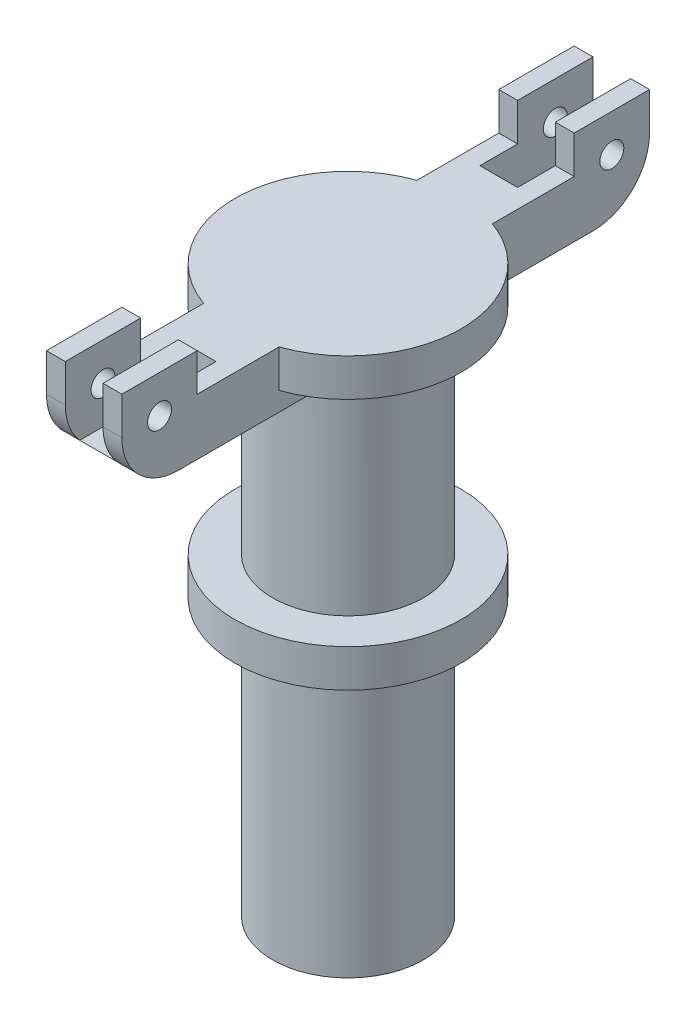
from build123d import *

# Parameters (mm, degrees)
SKETCH1_R            = 30
BOSS_EXTRUDE1_DEPTH  = 75
SKETCH2_W            = 10
SKETCH2_H            = 56.81
SKETCH2_H_2          = 73.19
SKETCH3_R            = 3.175
BOSS_EXTRUDE2_DEPTH  = 10
SKETCH5_W            = 10
SKETCH5_H            = 20
CUT_EXTRUDE2_DEPTH   = 30
FILLET1_R            = 15
FILLET1_OF_MIRROR1_R = 15


with BuildPart() as part:
    # Sketch1 → Boss-Extrude1 (new, symmetric)
    with BuildSketch(Plane(origin=(0, 0, 0), x_dir=(1, 0, 0), z_dir=(0, 1, 0))):
        with Locations(Location((0, 0, 0), (0, 0, 270))):
            Circle(SKETCH1_R)
    extrude(amount=BOSS_EXTRUDE1_DEPTH, both=True)

    # Sketch2 → Cut-Revolve1 (revolve, cut)
    with BuildSketch(Plane(origin=(0, 0, 0), x_dir=(0, 0, -1), z_dir=(1, 0, 0))):
        with Locations((25, 36.595)):
            Rectangle(SKETCH2_W, SKETCH2_H)
        with Locations((25, -38.405)):
            Rectangle(SKETCH2_W, SKETCH2_H_2)
    revolve(axis=Axis((0, -1000, 0), (0, 1, 0)), mode=Mode.SUBTRACT)

    # Sketch3 → Boss-Extrude2 (add, symmetric)
    with BuildSketch(Plane(origin=(0, 0, 0), x_dir=(0, 0, -1), z_dir=(1, 0, 0))):
        Polygon((0, 75), (0, 60), (70, 60), (70, 85), (50, 85), (50, 75), align=None)
        with Locations((60, 75)):
            Circle(SKETCH3_R, mode=Mode.SUBTRACT)
    boss_extrude2 = extrude(amount=BOSS_EXTRUDE2_DEPTH, both=True)

    # Sketch5 → Cut-Extrude2 (cut)
    with BuildSketch(Plane(origin=(0, 0, -70), x_dir=(-1, 0, 0), z_dir=(0, 0, -1))):
        with Locations((0, 75)):
            Rectangle(SKETCH5_W, SKETCH5_H)
    cut_extrude2 = extrude(amount=-CUT_EXTRUDE2_DEPTH, mode=Mode.SUBTRACT)

    # Fillet1
    # the kernel refuses this fillet: 15 mm, written as the material it takes off along each edge
    with BuildSketch(Plane(origin=(-47.5, 60, -70), x_dir=(0, 0, 1), z_dir=(1, 0, 0))) as fillet1_piece_1:
        with BuildLine():
            CenterArc((FILLET1_R, -FILLET1_R), FILLET1_R, 90, 90)
            Line((0, -FILLET1_R), (0, 0))
            Line((0, 0), (FILLET1_R, 0))
        make_face()
    extrude(amount=95, mode=Mode.SUBTRACT)

    # Mirror1: Boss-Extrude2, Cut-Extrude2 across plane
    add(boss_extrude2.mirror(Plane.XY))
    add(cut_extrude2.mirror(Plane.XY), mode=Mode.SUBTRACT)

    # Fillet1 of Mirror1
    # the kernel refuses this fillet: 15 mm, written as the material it takes off along each edge
    with BuildSketch(Plane(origin=(-47.5, 60, 70), x_dir=(0, 0, -1), z_dir=(1, 0, 0))) as fillet1_of_mirror1_piece_1:
        with BuildLine():
            CenterArc((FILLET1_OF_MIRROR1_R, FILLET1_OF_MIRROR1_R), FILLET1_OF_MIRROR1_R, 180, 90)
            Line((0, FILLET1_OF_MIRROR1_R), (0, 0))
            Line((0, 0), (FILLET1_OF_MIRROR1_R, 0))
        make_face()
    extrude(amount=95, mode=Mode.SUBTRACT)


solid = part.part
